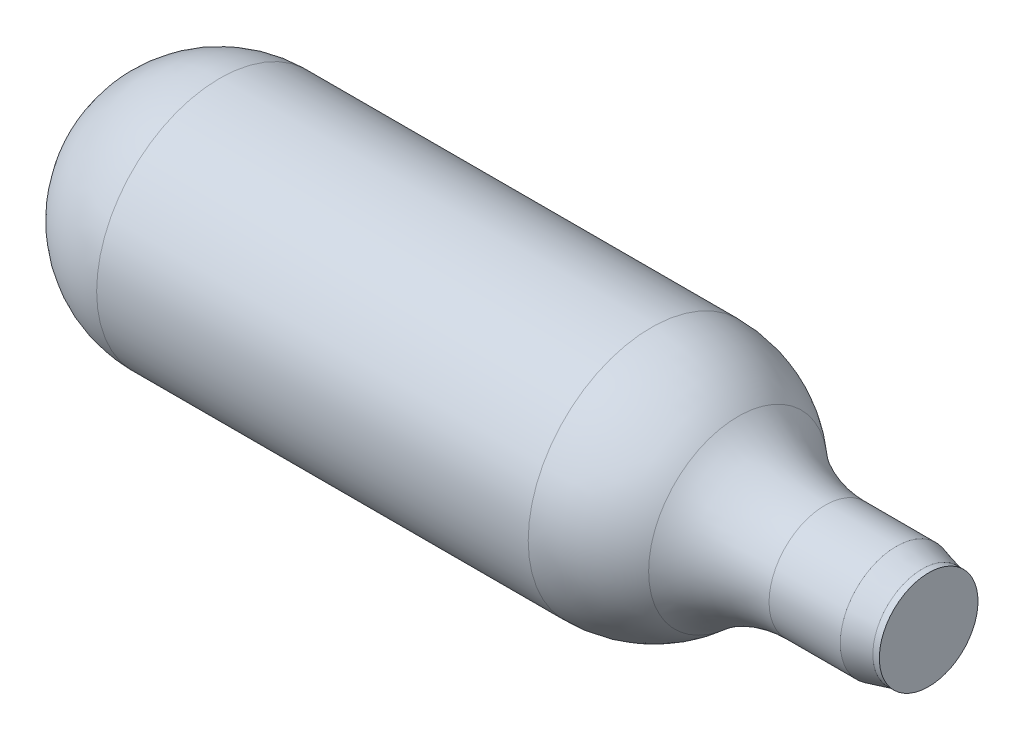
from build123d import *

# Parameters (mm, degrees)
SKETCH2_OUTSIDE_W  = 34.928
SKETCH2_OUTSIDE_H  = 34.928
SKETCH2_OUTSIDE_R  = 3.81
CUT_EXTRUDE1_DEPTH = 0.5
CHAMFER1_SIZE2     = 2
CHAMFER1_SIZE      = 0.515


with BuildPart() as part:
    # Sketch1 → Revolve1 (revolve)
    with BuildSketch(Plane.XY, mode=Mode.PRIVATE) as revolve1_sk:
        with BuildLine():
            Line((0, 0), (64.25, 0))
            Line((64.25, 0), (64.25, 4.325))
            Line((64.25, 4.325), (56.25, 4.325))
            ThreePointArc((56.25, 4.325), (52.653126358, 4.994271197), (49.5377095, 6.9125))
            ThreePointArc((49.5377095, 6.9125), (46.422292643, 8.830728803), (42.825419001, 9.5))
            Line((42.825419001, 9.5), (9.5, 9.5))
            ThreePointArc((9.5, 9.5), (2.782485579, 6.717514421), (0, 0))
        make_face()
    revolve(revolve1_sk.sketch.rotate(Axis((71.903875566, 0, 0), (1, 0, 0)), 90), axis=Axis((71.903875566, 0, 0), (1, 0, 0)))

    # Sketch2 outside → Cut-Extrude1 (cut)
    with BuildSketch(Plane(origin=(64.25, 0, 0), x_dir=(0, 0, -1), z_dir=(1, 0, 0))):
        Rectangle(SKETCH2_OUTSIDE_W, SKETCH2_OUTSIDE_H)
        Circle(SKETCH2_OUTSIDE_R, mode=Mode.SUBTRACT)
    extrude(amount=-CUT_EXTRUDE1_DEPTH, mode=Mode.SUBTRACT)

    # Chamfer1
    chamfer1_edges = [part.edges().sort_by_distance(p)[0] for p in [
        (63.75, 0, -4.325),
    ]]
    chamfer1_side = [part.faces().sort_by_distance(p)[0] for p in [
        (63.75, 0, -4.3147),
    ]]
    chamfer(chamfer1_edges, length=CHAMFER1_SIZE - 0.0001, length2=CHAMFER1_SIZE2 - 0.0001, reference=chamfer1_side[0])  # a hair under: the kernel refuses the full size


solid = part.part
